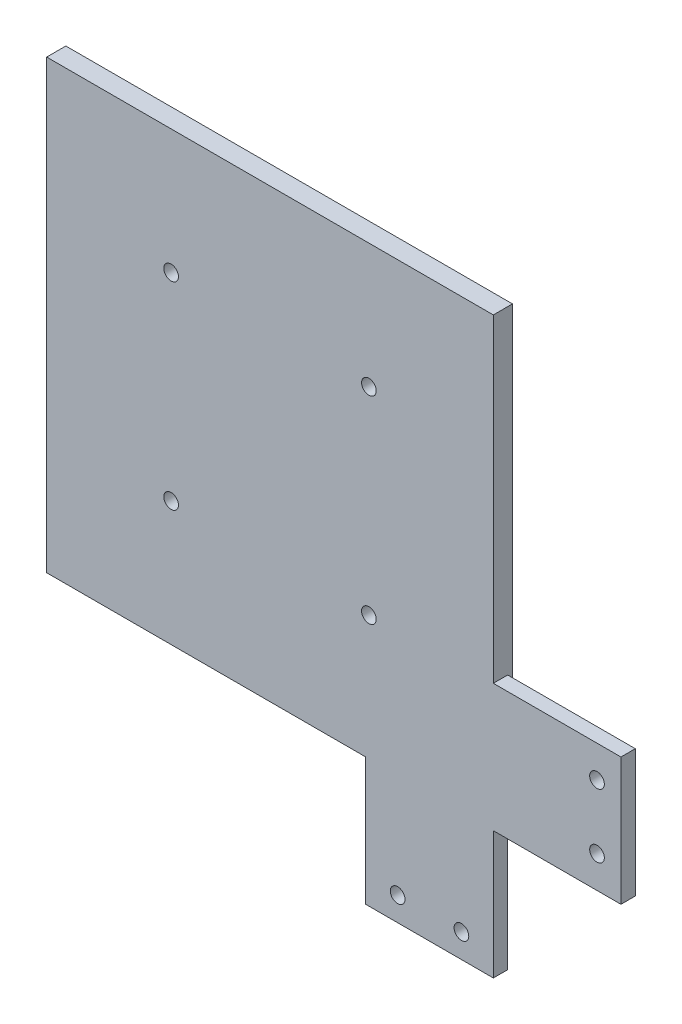
from build123d import *

# Parameters (mm, degrees)
SKETCH1_W           = 140
SKETCH1_H           = 140
SKETCH1_R           = 2.3
BOSS_EXTRUDE1_DEPTH = 6
SKETCH2_W           = 40
SKETCH2_H           = 40
SKETCH2_R           = 2.3
BOSS_EXTRUDE2_DEPTH = 4.5


with BuildPart() as part:
    # Sketch1 → Boss-Extrude1 (new body)
    with BuildSketch(Plane(origin=(0, 0, -16.6), x_dir=(1, 0, 0), z_dir=(0, 0, -1))):
        Rectangle(SKETCH1_W, SKETCH1_H)
        with Locations((-31, -31)):
            Circle(SKETCH1_R, mode=Mode.SUBTRACT)
        with Locations((-31, 31)):
            Circle(SKETCH1_R, mode=Mode.SUBTRACT)
        with Locations((31, 31)):
            Circle(SKETCH1_R, mode=Mode.SUBTRACT)
        with Locations((31, -31)):
            Circle(SKETCH1_R, mode=Mode.SUBTRACT)
    extrude(amount=BOSS_EXTRUDE1_DEPTH)

    # Sketch2 → Boss-Extrude2 (add)
    # profile 1 of 2: a face of its own
    with BuildSketch(Plane.XY.offset(-16.6)):
        with Locations((90, -50)):
            Rectangle(SKETCH2_W, SKETCH2_H)
        with Locations((102.5, -60)):
            Circle(SKETCH2_R, mode=Mode.SUBTRACT)
        with Locations((102.5, -40)):
            Circle(SKETCH2_R, mode=Mode.SUBTRACT)
    # profile 2 of 2: a face of its own
    with BuildSketch(Plane.XY.offset(-16.6)):
        with Locations((50, -90)):
            Rectangle(SKETCH2_W, SKETCH2_H)
        with Locations((40, -102.5)):
            Circle(SKETCH2_R, mode=Mode.SUBTRACT)
        with Locations((60, -102.5)):
            Circle(SKETCH2_R, mode=Mode.SUBTRACT)
    extrude(amount=-BOSS_EXTRUDE2_DEPTH)


solid = part.part
